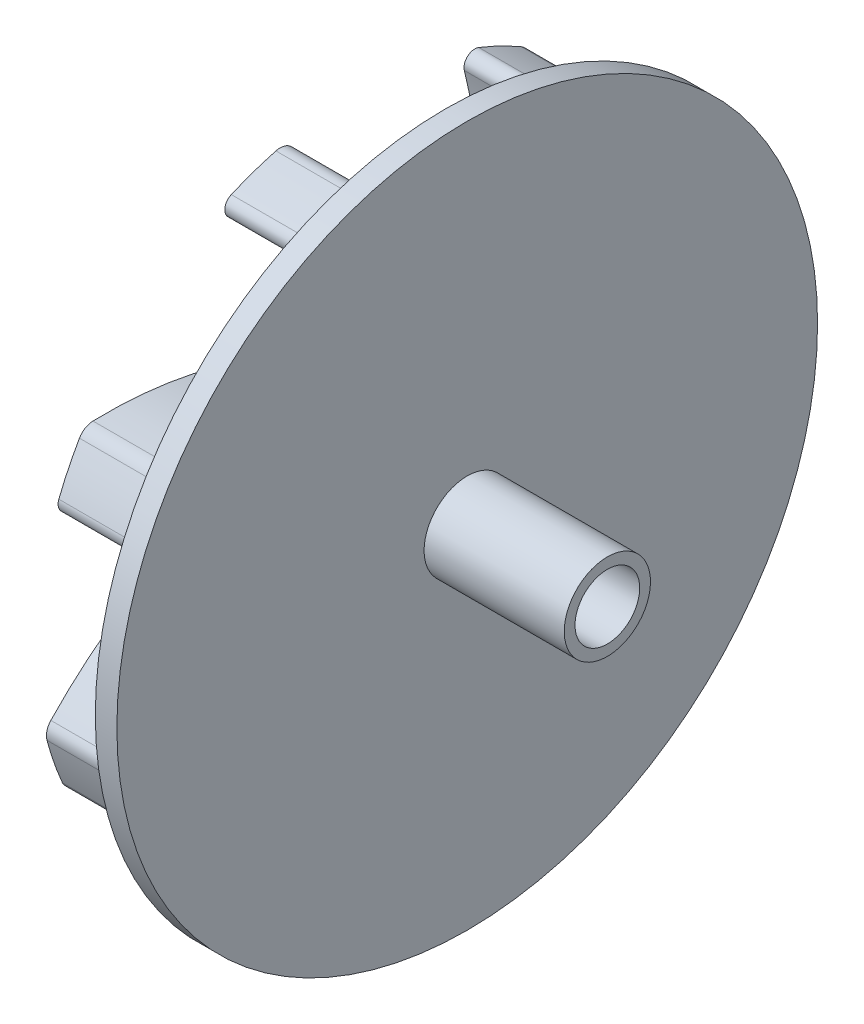
from build123d import *

# Parameters (mm, degrees)
SKETCH3_W           = 10
SKETCH3_H           = 30
SKETCH4_R           = 3
CUT_EXTRUDE2_DEPTH  = 10
CUT_EXTRUDE3_START  = 2
SKETCH5_R           = 30
SKETCH5_R_2         = 4.5
CUT_EXTRUDE3_DEPTH  = 2
FILLET2_R           = 1.5
CUT_EXTRUDE6_START  = -8
CUT_EXTRUDE6_DEPTH  = 8
FILLET3_R           = 1.5
FILLET4_R           = 1
SKETCH11_R          = 32.5
SKETCH11_R_2        = 3
BOSS_EXTRUDE4_DEPTH = 2
SKETCH12_R          = 4
SKETCH12_R_2        = 3
BOSS_EXTRUDE5_DEPTH = 15


with BuildPart() as part:
    # Sketch3 → Revolve3 (revolve)
    with BuildSketch(Plane.XY):
        with Locations((5, 15)):
            Rectangle(SKETCH3_W, SKETCH3_H)
    revolve(axis=Axis((10, 0, 0), (-1, 0, 0)))

    # Sketch4 → Cut-Extrude2 (cut)
    with BuildSketch(Plane(origin=(0, 0, 0), x_dir=(0, 0, -1), z_dir=(1, 0, 0))):
        Circle(SKETCH4_R)
    extrude(amount=CUT_EXTRUDE2_DEPTH, mode=Mode.SUBTRACT)

    # Sketch5 → Cut-Extrude3 (cut)
    with BuildSketch(Plane(origin=(0, 0, 0), x_dir=(0, 0, -1), z_dir=(1, 0, 0)).offset(CUT_EXTRUDE3_START)):
        with Locations(Location((0, 0, 0), (0, 0, 90))):
            Circle(SKETCH5_R)
        Circle(SKETCH5_R_2, mode=Mode.SUBTRACT)
    extrude(amount=-CUT_EXTRUDE3_DEPTH, mode=Mode.SUBTRACT)

    # Fillet2
    fillet2_edges = [part.edges().sort_by_distance(p)[0] for p in [
        (0, 0, 4.5),
    ]]
    fillet(fillet2_edges, radius=FILLET2_R - 0.0001)  # a hair under: the kernel refuses the full size

    # Sketch6 → Cut-Extrude6 (cut)
    with BuildSketch(Plane.ZY.offset(-2).offset(CUT_EXTRUDE6_START)):
        with BuildLine():
            ThreePointArc((-3.911197191, -5.805388577), (-17.732937141, -1.783831627), (-29.187621061, 6.934174556))
            ThreePointArc((-29.187621061, 6.934174556), (-29.97689762, -1.177118976), (-28.554011024, -9.201546306))
            ThreePointArc((-28.554011024, -9.201546306), (-15.193906429, -10.611164811), (-2.377494131, -6.583883478))
            ThreePointArc((-2.377494131, -6.583883478), (-3.168347079, -6.241920921), (-3.911197191, -5.805388577))
        make_face()
        with BuildLine():
            ThreePointArc((-6.870663687, -1.339395574), (-13.800439543, 11.277720662), (-15.735562929, 25.54196663))
            ThreePointArc((-15.735562929, 25.54196663), (-22.029216396, 20.364518776), (-26.697210616, 13.684259035))
            ThreePointArc((-26.697210616, 13.684259035), (-18.246940863, 3.240487675), (-6.336650876, -2.974366432))
            ThreePointArc((-6.336650876, -2.974366432), (-6.654064316, -2.173344906), (-6.870663687, -1.339395574))
        make_face()
        with BuildLine():
            ThreePointArc((-25.54196663, -15.735562929), (-20.364518776, -22.029216396), (-13.684259035, -26.697210616))
            ThreePointArc((-13.684259035, -26.697210616), (-3.240487675, -18.246940863), (2.974366432, -6.336650876))
            ThreePointArc((2.974366432, -6.336650876), (2.173344906, -6.654064316), (1.339395574, -6.870663687))
            ThreePointArc((1.339395574, -6.870663687), (-11.277720662, -13.800439543), (-25.54196663, -15.735562929))
        make_face()
        with BuildLine():
            ThreePointArc((-6.934174556, -29.187621061), (1.177118976, -29.97689762), (9.201546306, -28.554011024))
            ThreePointArc((9.201546306, -28.554011024), (10.611164811, -15.193906429), (6.583883478, -2.377494131))
            ThreePointArc((6.583883478, -2.377494131), (6.241920921, -3.168347079), (5.805388577, -3.911197191))
            ThreePointArc((5.805388577, -3.911197191), (1.783831627, -17.732937141), (-6.934174556, -29.187621061))
        make_face()
        with BuildLine():
            ThreePointArc((15.735562929, -25.54196663), (22.029216396, -20.364518776), (26.697210616, -13.684259035))
            ThreePointArc((26.697210616, -13.684259035), (18.246940863, -3.240487675), (6.336650876, 2.974366432))
            ThreePointArc((6.336650876, 2.974366432), (6.654064316, 2.173344906), (6.870663687, 1.339395574))
            ThreePointArc((6.870663687, 1.339395574), (13.800439543, -11.277720662), (15.735562929, -25.54196663))
        make_face()
        with BuildLine():
            ThreePointArc((29.187621061, -6.934174556), (29.796213114, -3.49079992), (30, 0))
            ThreePointArc((30, 0), (29.636298105, 4.657234655), (28.554011024, 9.201546306))
            ThreePointArc((28.554011024, 9.201546306), (15.193906429, 10.611164811), (2.377494131, 6.583883478))
            ThreePointArc((2.377494131, 6.583883478), (3.168347079, 6.241920921), (3.911197191, 5.805388577))
            ThreePointArc((3.911197191, 5.805388577), (17.732937141, 1.783831627), (29.187621061, -6.934174556))
        make_face()
        with BuildLine():
            ThreePointArc((-1.339395574, 6.870663687), (11.277720662, 13.800439543), (25.54196663, 15.735562929))
            ThreePointArc((25.54196663, 15.735562929), (20.364518776, 22.029216396), (13.684259035, 26.697210616))
            ThreePointArc((13.684259035, 26.697210616), (3.240487675, 18.246940863), (-2.974366432, 6.336650876))
            ThreePointArc((-2.974366432, 6.336650876), (-2.173344906, 6.654064316), (-1.339395574, 6.870663687))
        make_face()
        with BuildLine():
            ThreePointArc((-5.805388577, 3.911197191), (-1.783831627, 17.732937141), (6.934174556, 29.187621061))
            ThreePointArc((6.934174556, 29.187621061), (-1.177118976, 29.97689762), (-9.201546306, 28.554011024))
            ThreePointArc((-9.201546306, 28.554011024), (-10.611164811, 15.193906429), (-6.583883478, 2.377494131))
            ThreePointArc((-6.583883478, 2.377494131), (-6.241920921, 3.168347079), (-5.805388577, 3.911197191))
        make_face()
    extrude(amount=CUT_EXTRUDE6_DEPTH, mode=Mode.SUBTRACT)

    # Fillet3
    fillet3_edges = [part.edges().sort_by_distance(p)[0] for p in [
        (6, 15.735562929, 25.54196663),
        (6, 29.187621061, 6.934174556),
        (6, 6.934174556, -29.187621061),
        (6, 25.54196663, -15.735562929),
        (6, -15.735562929, -25.54196663),
        (6, -29.187621061, -6.934174556),
        (6, -25.54196663, 15.735562929),
        (6, -6.934174556, 29.187621061),
    ]]
    fillet(fillet3_edges, radius=FILLET3_R)

    # Fillet4
    fillet4_edges = [part.edges().sort_by_distance(p)[0] for p in [
        (6, 26.697210616, 13.684259035),
        (6, 28.554011024, -9.201546306),
        (6, -9.201546306, -28.554011024),
        (6, 13.684259035, -26.697210616),
        (6, -26.697210616, -13.684259035),
        (6, -28.554011024, 9.201546306),
        (6, -13.684259035, 26.697210616),
        (6, 9.201546306, 28.554011024),
    ]]
    fillet(fillet4_edges, radius=FILLET4_R)

    # Sketch11 → Boss-Extrude4 (add)
    with BuildSketch(Plane(origin=(10, 0, 0), x_dir=(0, 0, -1), z_dir=(1, 0, 0))):
        with Locations(Location((0, 0, 0), (0, 0, 90))):
            Circle(SKETCH11_R)
        with Locations(Location((0, 0, 0), (0, 0, 90))):
            Circle(SKETCH11_R_2, mode=Mode.SUBTRACT)
    extrude(amount=BOSS_EXTRUDE4_DEPTH)

    # Sketch12 → Boss-Extrude5 (add)
    with BuildSketch(Plane(origin=(10, 0, 0), x_dir=(0, 0, -1), z_dir=(1, 0, 0))):
        with Locations(Location((0, 0, 0), (0, 0, 90))):
            Circle(SKETCH12_R)
        with Locations(Location((0, 0, 0), (0, 0, 90))):
            Circle(SKETCH12_R_2, mode=Mode.SUBTRACT)
    extrude(amount=BOSS_EXTRUDE5_DEPTH)


solid = part.part
